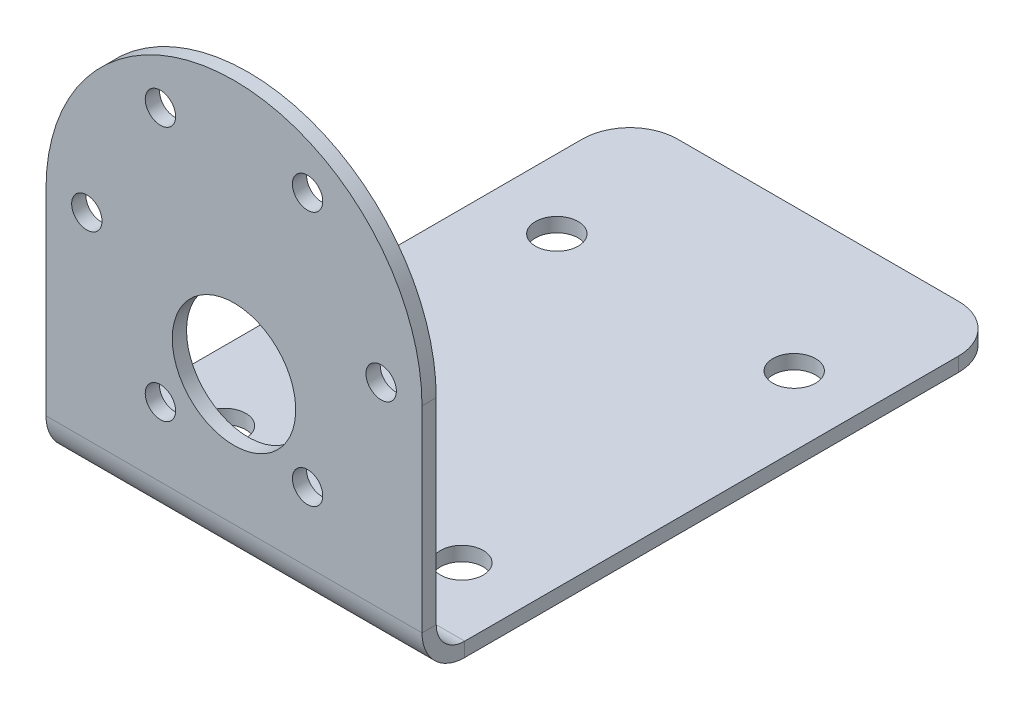
from build123d import *

# Parameters (mm, degrees)
BOSS_EXTRUDE1_DEPTH                     = 1.5
SKETCH2_R                               = 1.6
MOT_MNT_SCREW_HOLE_DEPTH                = 34.354609876
MOT_MNT_SCREW_HOLES_COUNT               = 2
MOT_MNT_SCREW_HOLES_ANGLE               = 60
MOT_MNT_SCREW_HOLES_THE_OTHER_WAY_COUNT = 2
MOT_MNT_SCREW_HOLES_THE_OTHER_WAY_ANGLE = 60
SKETCH3_W                               = 19.8
SKETCH3_H                               = 1.5
BASE_FLANGE_DEPTH                       = 60
SKETCH4_R                               = 2.25
BASE_MNT_SCREW_HOLES_DEPTH              = 77.709125924
FILLET1_R                               = 5
CONVERT_SOLID2_START                    = -19.8
CONVERT_SOLID2_DEPTH                    = 39.6
CONVERT_SOLID2_2_DEPTH                  = 39.6


# Read off the part's stored shape, not the designer's step: Convert-Solid2
with BuildPart() as part:
    # Sketch1 → Boss-Extrude1 (new body)
    with BuildSketch(Plane.XY):
        with BuildLine():
            Line((0, 26.8), (0, 6.5))
            ThreePointArc((0, 6.5), (-6.5, 0), (0, -6.5))
            Line((0, -6.5), (0, -18.2))
            Line((0, -18.2), (-19.8, -18.2))
            Line((-19.8, -18.2), (-19.8, 7))
            ThreePointArc((-19.8, 7), (-14.000714267, 21.000714267), (0, 26.8))
        make_face()
    extrude(amount=BOSS_EXTRUDE1_DEPTH)

    # Sketch2 → mot mnt screw hole (cut, through all)
    with BuildSketch(Plane.XY.offset(1.5)):
        with Locations((-15.5, 7)):
            Circle(SKETCH2_R)
    mot_mnt_screw_hole = extrude(amount=-MOT_MNT_SCREW_HOLE_DEPTH, mode=Mode.SUBTRACT)

    # mot mnt screw holes: mot mnt screw hole ×2 about axis
    mot_mnt_screw_holes_axis = Axis((0, 7, 1.5), (0, 0, -1))
    for i in range(1, MOT_MNT_SCREW_HOLES_COUNT):
        add(mot_mnt_screw_hole.rotate(mot_mnt_screw_holes_axis, i * MOT_MNT_SCREW_HOLES_ANGLE / (MOT_MNT_SCREW_HOLES_COUNT - 1)), mode=Mode.SUBTRACT)

    # mot mnt screw holes the other way: mot mnt screw hole ×2 about axis
    mot_mnt_screw_holes_the_other_way_axis = Axis((0, 7, 1.5), (0, 0, 1))
    for i in range(1, MOT_MNT_SCREW_HOLES_THE_OTHER_WAY_COUNT):
        add(mot_mnt_screw_hole.rotate(mot_mnt_screw_holes_the_other_way_axis, i * MOT_MNT_SCREW_HOLES_THE_OTHER_WAY_ANGLE / (MOT_MNT_SCREW_HOLES_THE_OTHER_WAY_COUNT - 1)), mode=Mode.SUBTRACT)

    # Sketch3 → base flange (add)
    with BuildSketch(Plane(origin=(0, 0, 0), x_dir=(-1, 0, 0), z_dir=(0, 0, -1))):
        with Locations((9.9, -17.45)):
            Rectangle(SKETCH3_W, SKETCH3_H)
    extrude(amount=BASE_FLANGE_DEPTH)

    # Sketch4 → base mnt screw holes (cut, through all)
    with BuildSketch(Plane(origin=(0, -16.7, 0), x_dir=(1, 0, 0), z_dir=(0, 1, 0))):
        with Locations(Location((-12.5, 10, 0), (0, 0, 270))):
            Circle(SKETCH4_R)
        with Locations(Location((-12.5, 45, 0), (0, 0, 270))):
            Circle(SKETCH4_R)
    extrude(amount=-BASE_MNT_SCREW_HOLES_DEPTH, mode=Mode.SUBTRACT)

    # Fillet1
    fillet1_edges = [part.edges().sort_by_distance(p)[0] for p in [
        (-19.8, -17.45, -60),
    ]]
    fillet(fillet1_edges, radius=FILLET1_R)

    # Mirror1: part across plane


with BuildPart() as part_1:
    add(part.part)
    add(part.part.mirror(Plane(origin=(0, 0, 0), x_dir=(0, 0, 1), z_dir=(1, 0, 0))))

    # Convert-Solid2 outline → Convert-Solid2 (cut)
    with BuildSketch(Plane.YZ.offset(CONVERT_SOLID2_START)):
        with BuildLine():
            ThreePointArc((-18.2, -3), (-16.881980515, 0.181980515), (-13.7, 1.5))
            Line((-13.7, 1.5), (-18.2, 1.5))
            Line((-18.2, 1.5), (-18.2, -3))
        make_face()
    extrude(amount=CONVERT_SOLID2_DEPTH, mode=Mode.SUBTRACT)

    # Convert-Solid2 2 outline → Convert-Solid2 2 (add)
    with BuildSketch(Plane.YZ.offset(CONVERT_SOLID2_START)):
        with BuildLine():
            ThreePointArc((-16.7, -3), (-15.821320344, -0.878679656), (-13.7, 0))
            Line((-13.7, 0), (-16.7, 0))
            Line((-16.7, 0), (-16.7, -3))
        make_face()
    extrude(amount=CONVERT_SOLID2_2_DEPTH)


solid = part_1.part
